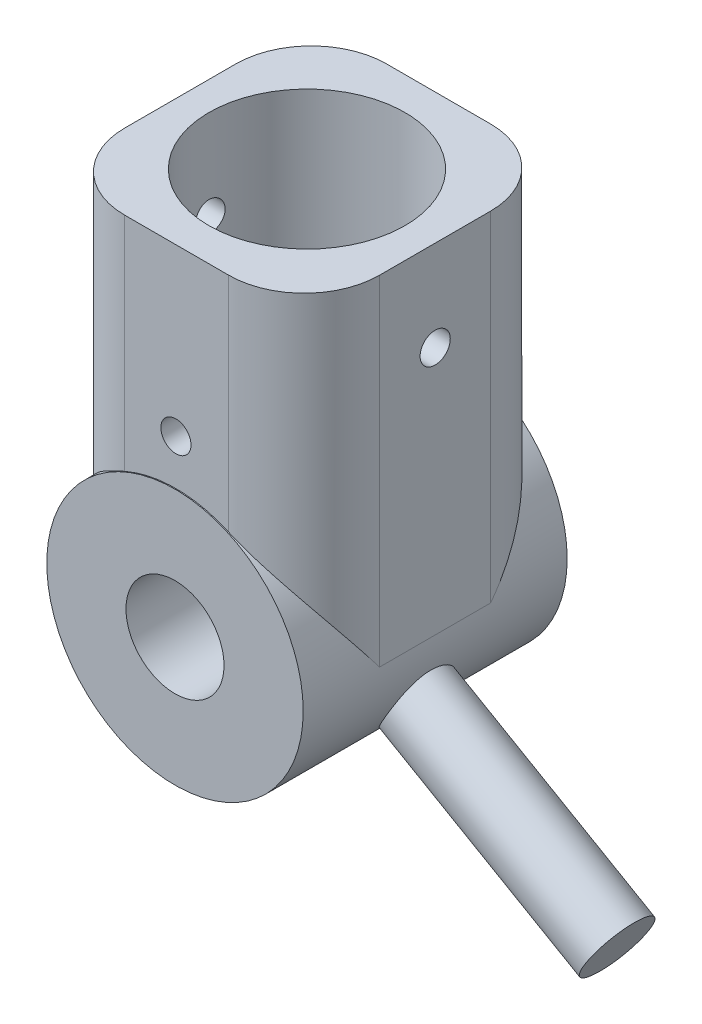
from build123d import *
from build123d.topology import SkipClean

# Parameters (mm, degrees)
SKETCH_1_R                        = 17
SKETCH_1_R_2                      = 6.5
EXTRUDE_2_DEPTH                   = 35
SKETCH_3_W                        = 33.795275063
SKETCH_3_H                        = 34.72803434
SKETCH_3_R                        = 13
EXTRUDE_7_DEPTH                   = 45
SKETCH_4_R                        = 6.5
CUT_EXTRUDE_1_DEPTH               = 60.489495005
SKETCH_12_R                       = 2
CUT_EXTRUDE_11_DEPTH              = 45
SKETCH_15_R                       = 2
CUT_EXTRUDE_12_DEPTH              = 45
FILLET_4_R                        = 10
SKETCH_20_R                       = 13
CUT_EXTRUDE_18_DEPTH              = 31
EXTRUDE_START                     = 1
SKETCH_25_R                       = 13
EXTRUDE_10_DEPTH                  = 1
SKETCH_26_R                       = 11.25
CUT_EXTRUDE_19_DEPTH              = 7.5
SKETCH_36_R                       = 4.5
SKETCH_36_R_2                     = 2
EXTRUDE_17_DEPTH                  = 15
EXTRUDE_17_DIRECTION_2_REACH      = 73.369
EXTRUDE_17_DIRECTION_2_END_RADIUS = 17
EXTRUDE_START_2                   = 3.5
EXTRUDE_18_DEPTH                  = 3.5
EXTRUDE_START_3                   = 12
SKETCH_41_R                       = 4.5
EXTRUDE_19_DEPTH                  = 12


with BuildPart() as part:
    # Эскиз1 → Бобышка-Вытянуть2 (new body)
    with BuildSketch(Plane.XY):
        Circle(SKETCH_1_R)
        Circle(SKETCH_1_R_2, mode=Mode.SUBTRACT)
    extrude(amount=EXTRUDE_2_DEPTH)

    # Эскиз3 → Бобышка-Вытянуть7 (add)
    with BuildSketch(Plane(origin=(0, 45, 0), x_dir=(1, 0, 0), z_dir=(0, 1, 0))):
        with Locations((0.102362468, -17.511098906)):
            Rectangle(SKETCH_3_W, SKETCH_3_H)
        with Locations(Location((0, -17.5, 0), (0, 0, 270))):
            Circle(SKETCH_3_R, mode=Mode.SUBTRACT)
    extrude(amount=-EXTRUDE_7_DEPTH)

    # Эскиз4 → Вырез-Вытянуть1 (cut, through all)
    with BuildSketch(Plane(origin=(0, 0, 0), x_dir=(-1, 0, 0), z_dir=(0, 0, -1))):
        with Locations(Location((0, 0, 0), (0, 0, 180))):
            Circle(SKETCH_4_R)
    extrude(amount=-CUT_EXTRUDE_1_DEPTH, mode=Mode.SUBTRACT)

    # Эскиз12 → Вырез-Вытянуть11 (cut)
    with BuildSketch(Plane(origin=(0, 0, 0), x_dir=(-1, 0, 0), z_dir=(0, 0, -1))):
        with Locations((0, 23)):
            Circle(SKETCH_12_R)
    extrude(amount=-CUT_EXTRUDE_11_DEPTH, mode=Mode.SUBTRACT)

    # Эскиз15 → Вырез-Вытянуть12 (cut)
    with BuildSketch(Plane.ZY.offset(16.795275063)):
        with Locations((17.5, 33)):
            Circle(SKETCH_15_R)
    extrude(amount=-CUT_EXTRUDE_12_DEPTH, mode=Mode.SUBTRACT)

    # Скругление4
    # the kernel refuses this fillet: 10 mm, written as the material it takes off along each edge
    with BuildSketch(Plane(origin=(-16.795275063, 70, 34.875116076), x_dir=(1, 0, 0), z_dir=(0, -1, 0))) as fillet_4_piece_1_section:
        with BuildLine():
            CenterArc((FILLET_4_R, -FILLET_4_R), FILLET_4_R, 90, 90)
            Line((0, -FILLET_4_R), (0, 0))
            Line((0, 0), (FILLET_4_R, 0))
        make_face()
    fillet_4_piece_1 = extrude(amount=92.369651061, mode=Mode.PRIVATE)
    fillet_4_piece_1 = fillet_4_piece_1 - Plane(origin=(0, 0, 32.54483178), x_dir=(1, 0, 0), z_dir=(0, 0, -1)) * Cylinder(17, 225, mode=Mode.PRIVATE)
    add(fillet_4_piece_1, mode=Mode.SUBTRACT)
    with BuildSketch(Plane(origin=(17, 70, 0.147081736), x_dir=(0, 0, 1), z_dir=(0, -1, 0))) as fillet_4_piece_2_section:
        with BuildLine():
            CenterArc((FILLET_4_R, FILLET_4_R), FILLET_4_R, 180, 90)
            Line((0, FILLET_4_R), (0, 0))
            Line((0, 0), (FILLET_4_R, 0))
        make_face()
    fillet_4_piece_2 = extrude(amount=95, mode=Mode.PRIVATE)
    fillet_4_piece_2 = fillet_4_piece_2 - Plane(origin=(0, 0, 2.486350956), x_dir=(1, 0, 0), z_dir=(0, 0, -1)) * Cylinder(17, 230, mode=Mode.PRIVATE)
    add(fillet_4_piece_2, mode=Mode.SUBTRACT)
    with BuildSketch(Plane(origin=(17, 70, 34.875116076), x_dir=(0, 0, -1), z_dir=(0, -1, 0))) as fillet_4_piece_3_section:
        with BuildLine():
            CenterArc((FILLET_4_R, -FILLET_4_R), FILLET_4_R, 90, 90)
            Line((0, -FILLET_4_R), (0, 0))
            Line((0, 0), (FILLET_4_R, 0))
        make_face()
    fillet_4_piece_3 = extrude(amount=95, mode=Mode.PRIVATE)
    fillet_4_piece_3 = fillet_4_piece_3 - Plane(origin=(0, 0, 32.535846855), x_dir=(1, 0, 0), z_dir=(0, 0, -1)) * Cylinder(17, 230, mode=Mode.PRIVATE)
    add(fillet_4_piece_3, mode=Mode.SUBTRACT)
    with BuildSketch(Plane(origin=(-16.795275063, 70, 0.147081736), x_dir=(0, 0, 1), z_dir=(0, -1, 0))) as fillet_4_piece_4_section:
        with BuildLine():
            CenterArc((FILLET_4_R, -FILLET_4_R), FILLET_4_R, 90, 90)
            Line((0, -FILLET_4_R), (0, 0))
            Line((0, 0), (FILLET_4_R, 0))
        make_face()
    fillet_4_piece_4 = extrude(amount=92.369651061, mode=Mode.PRIVATE)
    fillet_4_piece_4 = fillet_4_piece_4 - Plane(origin=(0, 0, 2.477367304), x_dir=(1, 0, 0), z_dir=(0, 0, -1)) * Cylinder(17, 225, mode=Mode.PRIVATE)
    add(fillet_4_piece_4, mode=Mode.SUBTRACT)

    # Эскиз20 → Вырез-Вытянуть18 (cut)
    with SkipClean():  # the faces are left unmerged after this step: merging them gives an invalid solid
        with BuildSketch(Plane(origin=(0, 45, 0), x_dir=(1, 0, 0), z_dir=(0, 1, 0))):
            with Locations(Location((0, -17.5, 0), (0, 0, 270))):
                Circle(SKETCH_20_R)
        extrude(amount=-CUT_EXTRUDE_18_DEPTH, mode=Mode.SUBTRACT)

    # Эскиз25 → Бобышка-Вытянуть10 (add)
    with BuildSketch(Plane(origin=(0, 14, 0), x_dir=(1, 0, 0), z_dir=(0, 1, 0)).offset(EXTRUDE_START)):
        with Locations(Location((0, -17.5, 0), (0, 0, 270))):
            Circle(SKETCH_25_R)
    extrude(amount=-EXTRUDE_10_DEPTH)

    # Эскиз26 → Вырез-Вытянуть19 (cut)
    with BuildSketch(Plane(origin=(0, 0, 0), x_dir=(-1, 0, 0), z_dir=(0, 0, -1))):
        Circle(SKETCH_26_R)
    extrude(amount=-CUT_EXTRUDE_19_DEPTH, mode=Mode.SUBTRACT)

    # Эскиз36 → Бобышка-Вытянуть17 (add)
    with BuildSketch(Plane(origin=(14.722431864, -8.5, 0), x_dir=(0, 0, -1), z_dir=(0.8660254037844346, -0.5000000000000071, 0))):
        with Locations(Location((-17.511098906, 0, 0), (0, 0, 270))):
            Circle(SKETCH_36_R)
        with Locations(Location((-17.511098906, 0, 0), (0, 0, 90))):
            Circle(SKETCH_36_R_2, mode=Mode.SUBTRACT)
    extrude(amount=EXTRUDE_17_DEPTH)

    # Бобышка-Вытянуть17 direction 2: up to this cylinder (the profile starts outside it)
    with SkipClean():  # the faces are left unmerged after this step: merging them gives an invalid solid
        extrude_17_direction_2_end = Plane(origin=(0, 0, 17.511099), z_dir=(0, 0, -1)) * Cylinder(EXTRUDE_17_DIRECTION_2_END_RADIUS, 181.738, mode=Mode.PRIVATE)
        # Эскиз36 → Бобышка-Вытянуть17 direction 2 (add, up to the surface)
        with BuildSketch(Plane(origin=(14.722431864, -8.5, 0), x_dir=(0, 0, -1), z_dir=(0.8660254037844346, -0.5000000000000071, 0)), mode=Mode.PRIVATE) as extrude_17_direction_2_sk1:
            with Locations(Location((-17.511098906, 0, 0), (0, 0, 270))):
                Circle(SKETCH_36_R)
            with Locations(Location((-17.511098906, 0, 0), (0, 0, 90))):
                Circle(SKETCH_36_R_2, mode=Mode.SUBTRACT)
        extrude_17_direction_2_tool1 = extrude(extrude_17_direction_2_sk1.sketch, amount=-EXTRUDE_17_DIRECTION_2_REACH, mode=Mode.PRIVATE) - extrude_17_direction_2_end
        add(extrude_17_direction_2_tool1.solids().sort_by_distance((16.908792, -4.713113, 17.511099))[0])
        add(extrude_17_direction_2_tool1.solids().sort_by_distance((16.908792, -4.713113, 17.511099))[1])

    # Эскиз40 → Бобышка-Вытянуть18 (add)
    with BuildSketch(Plane(origin=(27.712812921, -16, 0), x_dir=(0, 0, -1), z_dir=(0.8660254037844346, -0.5000000000000071, 0)).offset(EXTRUDE_START_2)):
        with BuildLine():
            Line((-15.998598906, 2.619726846), (-13.852269687, 2.619726846))
            ThreePointArc((-13.852269687, 2.619726846), (-22.011098906, 0), (-13.852269687, -2.619726846))
            Line((-13.852269687, -2.619726846), (-15.998598906, -2.619726846))
            Line((-15.998598906, -2.619726846), (-19.023598906, -2.619726846))
            Line((-19.023598906, -2.619726846), (-20.536098906, 0))
            Line((-20.536098906, 0), (-19.023598906, 2.619726846))
            Line((-19.023598906, 2.619726846), (-15.998598906, 2.619726846))
        make_face()
    extrude(amount=-EXTRUDE_18_DEPTH)

    # Эскиз41 → Бобышка-Вытянуть19 (add)
    with BuildSketch(Plane(origin=(30.743901834, -17.75, 0), x_dir=(0, 0, -1), z_dir=(0.8660254037844346, -0.5000000000000071, 0)).offset(EXTRUDE_START_3)):
        with Locations(Location((-17.511098906, 0, 0), (0, 0, 270))):
            Circle(SKETCH_41_R)
    extrude(amount=-EXTRUDE_19_DEPTH)


solid = part.part
